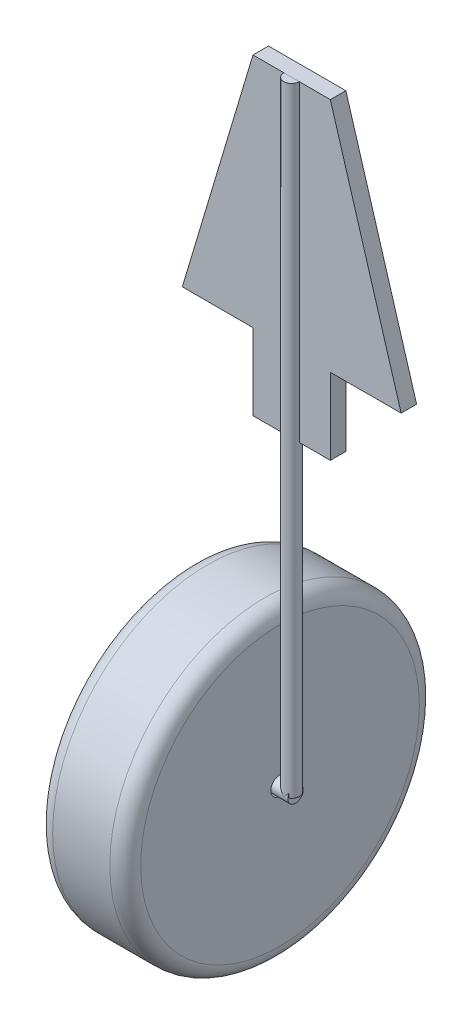
from build123d import *

# Parameters (mm, degrees)
SKETCH1_R                = 10
SKETCH1_R_2              = 0.6
BOSS_EXTRUDE1_DEPTH      = 5.69
FILLET2_R                = 1
FILLET3_R                = 1
BOSS_EXTRUDE2_DEPTH      = 1
BOSS_EXTRUDE2_DEPTH_BACK = 6
SKETCH2_R                = 0.5
SKETCH4_R                = 0.5
BOSS_EXTRUDE5_DEPTH      = 40
BOSS_EXTRUDE7_DEPTH      = 0.001
BOSS_EXTRUDE7_DEPTH_BACK = 1


with BuildPart() as part:
    # Sketch1 → Boss-Extrude1 (new body)
    with BuildSketch(Plane(origin=(0, 0, 0), x_dir=(0, 0, -1), z_dir=(1, 0, 0))):
        Circle(SKETCH1_R)
        Circle(SKETCH1_R_2, mode=Mode.SUBTRACT)
    extrude(amount=BOSS_EXTRUDE1_DEPTH)

    # Fillet2
    fillet2_edges = [part.edges().sort_by_distance(p)[0] for p in [
        (0, 0, 10),
    ]]
    fillet(fillet2_edges, radius=FILLET2_R)

    # Fillet3
    fillet3_edges = [part.edges().sort_by_distance(p)[0] for p in [
        (5.69, 0, 10),
    ]]
    fillet(fillet3_edges, radius=FILLET3_R)


with BuildPart() as body_2:
    # Sketch2 → Boss-Extrude2 (new, two sides: drawn at the far end of the back side and taken through both)
    with BuildSketch(Plane(origin=(5.69, 0, 0), x_dir=(0, 0, -1), z_dir=(1, 0, 0)).offset(-BOSS_EXTRUDE2_DEPTH_BACK)):
        Circle(SKETCH2_R)
    extrude(amount=BOSS_EXTRUDE2_DEPTH + BOSS_EXTRUDE2_DEPTH_BACK)

    # Sketch4 → Boss-Extrude5 (add)
    with BuildSketch(Plane(origin=(0, 0, 0), x_dir=(1, 0, 0), z_dir=(0, 1, 0))):
        with Locations((6.434798772, 0)):
            Circle(SKETCH4_R)
    extrude(amount=BOSS_EXTRUDE5_DEPTH)


with BuildPart() as body_3:
    # Sketch14 → Boss-Extrude7 (new, two sides: drawn at the far end of the back side and taken through both)
    with BuildSketch(Plane.XY.offset(-BOSS_EXTRUDE7_DEPTH_BACK)):
        Polygon((8.942784632, 40), (3.942784632, 40), (-0.623188676, 24.742004498), (3.942784632, 24.742004498), (3.942784632, 19.814002531), (8.942784632, 19.814002531), (8.942784632, 24.742004498), (13.516031921, 24.742004498), align=None)
    extrude(amount=BOSS_EXTRUDE7_DEPTH + BOSS_EXTRUDE7_DEPTH_BACK)


solid = Compound([part.part, body_2.part, body_3.part])
